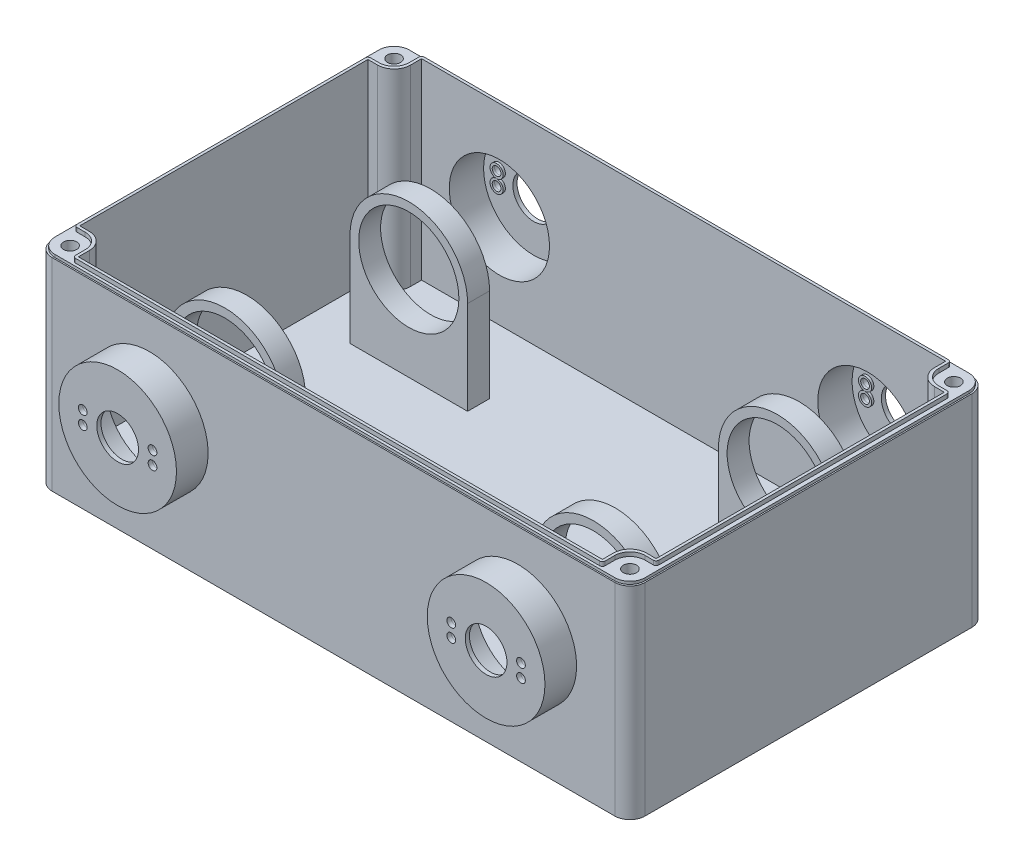
from build123d import *
from build123d.topology import SkipClean

# Parameters (mm, degrees)
SKETCH1_W              = 215.9
SKETCH1_H              = 130
BOSS_EXTRUDE1_DEPTH    = 73.7
SKETCH2_W              = 214.9
SKETCH2_H              = 129
BOSS_EXTRUDE2_DEPTH    = 1
FILLET1_R              = 5.5118
FILLET2_R              = 5.5118
M4_CLEARANCE_HOLE1_D   = 4.8
BOSS_EXTRUDE3_START    = 1.5
BOSS_EXTRUDE3_DEPTH    = 1.5
FILLET3_R              = 1
CUT_EXTRUDE2_DEPTH     = 69.85
SKETCH9_R              = 18.25
CUT_EXTRUDE3_DEPTH     = 186.363541453
BOSS_EXTRUDE5_START    = 10
SKETCH10_R             = 21.425
SKETCH10_R_2           = 18.25
BOSS_EXTRUDE5_DEPTH    = 10
BOSS_EXTRUDE6_START    = 1.525
SKETCH11_R             = 21.425
SKETCH11_R_2           = 7.59
BOSS_EXTRUDE6_DEPTH    = 1.525
SKETCH12_R             = 21.425
SKETCH12_R_2           = 18.25
BOSS_EXTRUDE7_DEPTH    = 10
SKETCH13_R             = 21.425
SKETCH13_R_2           = 7.59
BOSS_EXTRUDE8_DEPTH    = 1.525
BOSS_EXTRUDE9_START    = 25
SKETCH14_R             = 21.425
SKETCH14_R_2           = 18.25
BOSS_EXTRUDE9_DEPTH    = 8
BOSS_EXTRUDE9_2_DEPTH  = 8
BOSS_EXTRUDE11_DEPTH   = 8
BOSS_EXTRUDE12_START   = 25
SKETCH16_R             = 21.425
SKETCH16_R_2           = 18.25
BOSS_EXTRUDE12_DEPTH   = 8
BOSS_EXTRUDE12_2_DEPTH = 8
BOSS_EXTRUDE13_START   = -8
BOSS_EXTRUDE13_DEPTH   = 8
SKETCH18_R             = 1.5875
CUT_EXTRUDE4_DEPTH     = 203.197786833
SKETCH21_R             = 1.5875
BOSS_EXTRUDE14_DEPTH   = 0.825
BOSS_EXTRUDE14_2_DEPTH = 0.825
BOSS_EXTRUDE14_3_DEPTH = 0.825
BOSS_EXTRUDE14_4_DEPTH = 0.825
SKETCH22_R             = 1.5875
BOSS_EXTRUDE15_DEPTH   = 0.825
BOSS_EXTRUDE15_2_DEPTH = 0.825
BOSS_EXTRUDE15_3_DEPTH = 0.825
BOSS_EXTRUDE15_4_DEPTH = 0.825
SKETCH23_R             = 1.5875
BOSS_EXTRUDE16_DEPTH   = 0.825
BOSS_EXTRUDE16_2_DEPTH = 0.825
BOSS_EXTRUDE16_3_DEPTH = 0.825
BOSS_EXTRUDE16_4_DEPTH = 0.825
SKETCH24_R             = 1.5875
BOSS_EXTRUDE18_DEPTH   = 0.825
BOSS_EXTRUDE18_2_DEPTH = 0.825
BOSS_EXTRUDE18_3_DEPTH = 0.825
BOSS_EXTRUDE18_4_DEPTH = 0.825


with BuildPart() as part:
    # Sketch1 → Boss-Extrude1 (new body)
    with BuildSketch(Plane(origin=(0, 0, 0), x_dir=(1, 0, 0), z_dir=(0, 1, 0))):
        Rectangle(SKETCH1_W, SKETCH1_H)
    extrude(amount=BOSS_EXTRUDE1_DEPTH)

    # Sketch2 → Boss-Extrude2 (add)
    with BuildSketch(Plane(origin=(0, 73.7, 0), x_dir=(1, 0, 0), z_dir=(0, 1, 0))):
        Rectangle(SKETCH2_W, SKETCH2_H)
    extrude(amount=BOSS_EXTRUDE2_DEPTH)

    # Fillet1
    fillet1_edges = [part.edges().sort_by_distance(p)[0] for p in [
        (107.45, 74.2, -64.5),
        (107.45, 74.2, 64.5),
        (-107.45, 74.2, 64.5),
        (-107.45, 74.2, -64.5),
    ]]
    fillet(fillet1_edges, radius=FILLET1_R)

    # Fillet2
    fillet2_edges = [part.edges().sort_by_distance(p)[0] for p in [
        (-107.95, 36.85, 65),
        (107.95, 36.85, 65),
        (-107.95, 36.85, -65),
        (107.95, 36.85, -65),
    ]]
    fillet(fillet2_edges, radius=FILLET2_R)

    # M4 Clearance Hole1 (through all)
    with Locations(Plane(origin=(0, 74.7, 0), x_dir=(1, 0, 0), z_dir=(0, 1, 0))):
        with Locations((-101.9382, 58.9882), (-101.9382, -58.9882), (101.9382, -58.9882), (101.9382, 58.9882)):
            Hole(M4_CLEARANCE_HOLE1_D / 2)

    # Sketch7 → Boss-Extrude3 (add)
    with BuildSketch(Plane(origin=(0, 74.7, 0), x_dir=(1, 0, 0), z_dir=(0, 1, 0)).offset(BOSS_EXTRUDE3_START)):
        with BuildLine():
            Line((96.4264, 63.5), (-96.4264, 63.5))
            Line((-96.4264, 63.5), (-96.4264, 58.9882))
            ThreePointArc((-96.4264, 58.9882), (-98.040768843, 55.090768843), (-101.9382, 53.4764))
            Line((-101.9382, 53.4764), (-105.95, 53.4764))
            Line((-105.95, 53.4764), (-105.95, -53.4764))
            Line((-105.95, -53.4764), (-101.9382, -53.4764))
            ThreePointArc((-101.9382, -53.4764), (-98.040768843, -55.090768843), (-96.4264, -58.9882))
            Line((-96.4264, -58.9882), (-96.4264, -63.5))
            Line((-96.4264, -63.5), (96.4264, -63.5))
            Line((96.4264, -63.5), (96.4264, -58.9882))
            ThreePointArc((96.4264, -58.9882), (98.040768843, -55.090768843), (101.9382, -53.4764))
            Line((101.9382, -53.4764), (105.95, -53.4764))
            Line((105.95, -53.4764), (105.95, 53.4764))
            Line((105.95, 53.4764), (101.9382, 53.4764))
            ThreePointArc((101.9382, 53.4764), (98.040768843, 55.090768843), (96.4264, 58.9882))
            Line((96.4264, 58.9882), (96.4264, 63.5))
        make_face()
    extrude(amount=-BOSS_EXTRUDE3_DEPTH)

    # Fillet3
    fillet3_edges = [part.edges().sort_by_distance(p)[0] for p in [
        (96.4264, 75.45, 63.5),
        (105.95, 75.45, 53.4764),
        (105.95, 75.45, -53.4764),
        (96.4264, 75.45, -63.5),
        (-105.95, 75.45, -53.4764),
        (-96.4264, 75.45, -63.5),
        (-105.95, 75.45, 53.4764),
        (-96.4264, 75.45, 63.5),
    ]]
    fillet(fillet3_edges, radius=FILLET3_R)

    # Sketch8 → Cut-Extrude2 (cut)
    with BuildSketch(Plane(origin=(0, 76.2, 0), x_dir=(1, 0, 0), z_dir=(0, 1, 0))):
        with BuildLine():
            Line((95.4264, 62.5), (-95.4264, 62.5))
            Line((-95.4264, 62.5), (-95.4264, 58.4764))
            ThreePointArc((-95.4264, 58.4764), (-97.183759313, 54.233759313), (-101.4264, 52.4764))
            Line((-101.4264, 52.4764), (-104.95, 52.4764))
            Line((-104.95, 52.4764), (-104.95, -52.4764))
            Line((-104.95, -52.4764), (-101.4264, -52.4764))
            ThreePointArc((-101.4264, -52.4764), (-97.183759313, -54.233759313), (-95.4264, -58.4764))
            Line((-95.4264, -58.4764), (-95.4264, -62.5))
            Line((-95.4264, -62.5), (95.4264, -62.5))
            Line((95.4264, -62.5), (95.4264, -58.4764))
            ThreePointArc((95.4264, -58.4764), (97.183759313, -54.233759313), (101.4264, -52.4764))
            Line((101.4264, -52.4764), (104.95, -52.4764))
            Line((104.95, -52.4764), (104.95, 52.4764))
            Line((104.95, 52.4764), (101.4264, 52.4764))
            ThreePointArc((101.4264, 52.4764), (97.183759313, 54.233759313), (95.4264, 58.4764))
            Line((95.4264, 58.4764), (95.4264, 62.5))
        make_face()
    extrude(amount=-CUT_EXTRUDE2_DEPTH, mode=Mode.SUBTRACT)

    # Sketch9 → Cut-Extrude3 (cut, through all)
    with BuildSketch(Plane.XY.offset(65)):
        with Locations((-67.0941, 40.35)):
            Circle(SKETCH9_R)
        with Locations((67.0941, 40.35)):
            Circle(SKETCH9_R)
    extrude(amount=-CUT_EXTRUDE3_DEPTH, mode=Mode.SUBTRACT)

    # Sketch10 → Boss-Extrude5 (add)
    # profile 1 of 2: a face of its own
    with BuildSketch(Plane.XY.offset(65).offset(BOSS_EXTRUDE5_START)):
        with Locations((-67.0941, 40.35)):
            Circle(SKETCH10_R)
        with Locations((-67.0941, 40.35)):
            Circle(SKETCH10_R_2, mode=Mode.SUBTRACT)
    # profile 2 of 2: a face of its own
    with BuildSketch(Plane.XY.offset(65).offset(BOSS_EXTRUDE5_START)):
        with Locations((67.0941, 40.35)):
            Circle(SKETCH10_R)
        with Locations((67.0941, 40.35)):
            Circle(SKETCH10_R_2, mode=Mode.SUBTRACT)
    extrude(amount=-BOSS_EXTRUDE5_DEPTH)

    # Sketch11 → Boss-Extrude6 (add)
    # profile 1 of 2: a face of its own
    with BuildSketch(Plane.XY.offset(75).offset(BOSS_EXTRUDE6_START)):
        with Locations((-67.0941, 40.35)):
            Circle(SKETCH11_R)
        with Locations((-67.0941, 40.35)):
            Circle(SKETCH11_R_2, mode=Mode.SUBTRACT)
    # profile 2 of 2: a face of its own
    with BuildSketch(Plane.XY.offset(75).offset(BOSS_EXTRUDE6_START)):
        with Locations((67.0941, 40.35)):
            Circle(SKETCH11_R)
        with Locations((67.0941, 40.35)):
            Circle(SKETCH11_R_2, mode=Mode.SUBTRACT)
    extrude(amount=-BOSS_EXTRUDE6_DEPTH)

    # Sketch12 → Boss-Extrude7 (add)
    # profile 1 of 2: a face of its own
    with SkipClean():  # the faces are left unmerged after this step: merging them gives an invalid solid
        with BuildSketch(Plane(origin=(0, 0, -65), x_dir=(-1, 0, 0), z_dir=(0, 0, -1))):
            with Locations((-67.0941, 40.35)):
                Circle(SKETCH12_R)
            with Locations((-67.0941, 40.35)):
                Circle(SKETCH12_R_2, mode=Mode.SUBTRACT)
        # profile 2 of 2: a face of its own
        with BuildSketch(Plane(origin=(0, 0, -65), x_dir=(-1, 0, 0), z_dir=(0, 0, -1))):
            with Locations((67.0941, 40.35)):
                Circle(SKETCH12_R)
            with Locations((67.0941, 40.35)):
                Circle(SKETCH12_R_2, mode=Mode.SUBTRACT)
        extrude(amount=BOSS_EXTRUDE7_DEPTH)

    # Sketch13 → Boss-Extrude8 (add)
    # profile 1 of 2: a face of its own
    with SkipClean():  # the faces are left unmerged after this step: merging them gives an invalid solid
        with BuildSketch(Plane(origin=(0, 0, -75), x_dir=(-1, 0, 0), z_dir=(0, 0, -1))):
            with Locations((-67.0941, 40.35)):
                Circle(SKETCH13_R)
            with Locations((-67.0941, 40.35)):
                Circle(SKETCH13_R_2, mode=Mode.SUBTRACT)
        # profile 2 of 2: a face of its own
        with BuildSketch(Plane(origin=(0, 0, -75), x_dir=(-1, 0, 0), z_dir=(0, 0, -1))):
            with Locations((67.0941, 40.35)):
                Circle(SKETCH13_R)
            with Locations((67.0941, 40.35)):
                Circle(SKETCH13_R_2, mode=Mode.SUBTRACT)
        extrude(amount=BOSS_EXTRUDE8_DEPTH)



with BuildPart() as body_2:
    # Sketch14 → Boss-Extrude9 (new body)
    with BuildSketch(Plane.XY.offset(-62.5).offset(BOSS_EXTRUDE9_START)):
        with Locations((-67.0941, 40.35)):
            Circle(SKETCH14_R)
        with Locations((-67.0941, 40.35)):
            Circle(SKETCH14_R_2, mode=Mode.SUBTRACT)
    extrude(amount=BOSS_EXTRUDE9_DEPTH)


with BuildPart() as body_3:
    # Sketch14 → Boss-Extrude9 2 (new body)
    with BuildSketch(Plane.XY.offset(-62.5).offset(BOSS_EXTRUDE9_START)):
        with Locations((67.0941, 40.35)):
            Circle(SKETCH14_R)
        with Locations((67.0941, 40.35)):
            Circle(SKETCH14_R_2, mode=Mode.SUBTRACT)
    extrude(amount=BOSS_EXTRUDE9_2_DEPTH)


with BuildPart() as part_1:
    with SkipClean():  # the faces are left unmerged after this step: merging them gives an invalid solid
        add(part.part)

        add(body_2.part)  # Boss-Extrude11 merges body 2

        add(body_3.part)  # Boss-Extrude11 merges body 3
        # Sketch15 → Boss-Extrude11 (add)
        with BuildSketch(Plane.XY.offset(-29.5)):
            with BuildLine():
                ThreePointArc((-45.6691, 40.35), (-67.0941, 18.925), (-88.5191, 40.35))
                Line((-88.5191, 40.35), (-88.5191, 6.35))
                Line((-88.5191, 6.35), (-45.6691, 6.35))
                Line((-45.6691, 6.35), (-45.6691, 40.35))
            make_face()
            with BuildLine():
                ThreePointArc((88.5191, 40.35), (67.0941, 18.925), (45.6691, 40.35))
                Line((45.6691, 40.35), (45.6691, 6.35))
                Line((45.6691, 6.35), (88.5191, 6.35))
                Line((88.5191, 6.35), (88.5191, 40.35))
            make_face()
        extrude(amount=-BOSS_EXTRUDE11_DEPTH)



with BuildPart() as body_2_2:
    # Sketch16 → Boss-Extrude12 (new body)
    with BuildSketch(Plane(origin=(0, 0, 62.5), x_dir=(-1, 0, 0), z_dir=(0, 0, -1)).offset(BOSS_EXTRUDE12_START)):
        with Locations((-67.0941, 40.35)):
            Circle(SKETCH16_R)
        with Locations((-67.0941, 40.35)):
            Circle(SKETCH16_R_2, mode=Mode.SUBTRACT)
    extrude(amount=BOSS_EXTRUDE12_DEPTH)


with BuildPart() as body_3_2:
    # Sketch16 → Boss-Extrude12 2 (new body)
    with BuildSketch(Plane(origin=(0, 0, 62.5), x_dir=(-1, 0, 0), z_dir=(0, 0, -1)).offset(BOSS_EXTRUDE12_START)):
        with Locations((67.0941, 40.35)):
            Circle(SKETCH16_R)
        with Locations((67.0941, 40.35)):
            Circle(SKETCH16_R_2, mode=Mode.SUBTRACT)
    extrude(amount=BOSS_EXTRUDE12_2_DEPTH)


with BuildPart() as part_2:
    with SkipClean():  # the faces are left unmerged after this step: merging them gives an invalid solid
        add(part_1.part)

        add(body_2_2.part)  # Boss-Extrude13 merges body 2 2

        add(body_3_2.part)  # Boss-Extrude13 merges body 3 2
        # Sketch17 → Boss-Extrude13 (add)
        with BuildSketch(Plane(origin=(0, 0, 29.5), x_dir=(-1, 0, 0), z_dir=(0, 0, -1)).offset(BOSS_EXTRUDE13_START)):
            with BuildLine():
                ThreePointArc((-45.6691, 40.35), (-67.0941, 18.925), (-88.5191, 40.35))
                Line((-88.5191, 40.35), (-88.5191, 6.35))
                Line((-88.5191, 6.35), (-45.6691, 6.35))
                Line((-45.6691, 6.35), (-45.6691, 40.35))
            make_face()
            with BuildLine():
                Line((88.5191, 6.35), (88.5191, 40.35))
                ThreePointArc((88.5191, 40.35), (67.0941, 18.925), (45.6691, 40.35))
                Line((45.6691, 40.35), (45.6691, 6.35))
                Line((45.6691, 6.35), (88.5191, 6.35))
            make_face()
        extrude(amount=BOSS_EXTRUDE13_DEPTH)

    # Sketch18 → Cut-Extrude4 (cut, through all)
    with SkipClean():  # the faces are left unmerged after this step: merging them gives an invalid solid
        with BuildSketch(Plane(origin=(0, 0, -76.525), x_dir=(-1, 0, 0), z_dir=(0, 0, -1))):
            with Locations((-79.7941, 42.73125)):
                Circle(SKETCH18_R)
            with Locations((-79.7941, 37.96875)):
                Circle(SKETCH18_R)
            with Locations((-54.3941, 42.73125)):
                Circle(SKETCH18_R)
            with Locations((-54.3941, 37.96875)):
                Circle(SKETCH18_R)
        cut_extrude4 = extrude(amount=-CUT_EXTRUDE4_DEPTH, mode=Mode.SUBTRACT)

    # Mirror1: Cut-Extrude4 across plane
    with SkipClean():  # the faces are left unmerged after this step: merging them gives an invalid solid
        add(cut_extrude4.mirror(Plane(origin=(0, 0, 0), x_dir=(0, 0, 1), z_dir=(1, 0, 0))), mode=Mode.SUBTRACT)


with BuildPart() as body_2_3:
    # Sketch21 → Boss-Extrude14 (new body)
    with BuildSketch(Plane.XY.offset(-75)):
        with BuildLine():
            ThreePointArc((54.566740341, 40.35), (54.3941, 45.11875), (54.221459659, 40.35))
            ThreePointArc((54.221459659, 40.35), (54.3941, 40.35625), (54.566740341, 40.35))
        make_face()
        with Locations((54.3941, 42.73125)):
            Circle(SKETCH21_R, mode=Mode.SUBTRACT)
    extrude(amount=BOSS_EXTRUDE14_DEPTH)


with BuildPart() as body_3_3:
    # Sketch21 → Boss-Extrude14 2 (new body)
    with BuildSketch(Plane.XY.offset(-75)):
        with BuildLine():
            ThreePointArc((54.566740341, 40.35), (54.3941, 40.34375), (54.221459659, 40.35))
            ThreePointArc((54.221459659, 40.35), (54.3941, 35.58125), (54.566740341, 40.35))
        make_face()
        with Locations((54.3941, 37.96875)):
            Circle(SKETCH21_R, mode=Mode.SUBTRACT)
    extrude(amount=BOSS_EXTRUDE14_2_DEPTH)


with BuildPart() as body_4:
    # Sketch21 → Boss-Extrude14 3 (new body)
    with BuildSketch(Plane.XY.offset(-75)):
        with BuildLine():
            ThreePointArc((79.966740341, 40.35), (79.7941, 45.11875), (79.621459659, 40.35))
            ThreePointArc((79.621459659, 40.35), (79.7941, 40.35625), (79.966740341, 40.35))
        make_face()
        with Locations((79.7941, 42.73125)):
            Circle(SKETCH21_R, mode=Mode.SUBTRACT)
    extrude(amount=BOSS_EXTRUDE14_3_DEPTH)


with BuildPart() as body_5:
    # Sketch21 → Boss-Extrude14 4 (new body)
    with BuildSketch(Plane.XY.offset(-75)):
        with BuildLine():
            ThreePointArc((79.966740341, 40.35), (79.7941, 40.34375), (79.621459659, 40.35))
            ThreePointArc((79.621459659, 40.35), (79.7941, 35.58125), (79.966740341, 40.35))
        make_face()
        with Locations((79.7941, 37.96875)):
            Circle(SKETCH21_R, mode=Mode.SUBTRACT)
    extrude(amount=BOSS_EXTRUDE14_4_DEPTH)


with BuildPart() as body_6:
    # Sketch22 → Boss-Extrude15 (new body)
    with BuildSketch(Plane.XY.offset(-75)):
        with BuildLine():
            ThreePointArc((-79.621459659, 40.35), (-79.7941, 45.11875), (-79.966740341, 40.35))
            ThreePointArc((-79.966740341, 40.35), (-79.7941, 40.35625), (-79.621459659, 40.35))
        make_face()
        with Locations((-79.7941, 42.73125)):
            Circle(SKETCH22_R, mode=Mode.SUBTRACT)
    extrude(amount=BOSS_EXTRUDE15_DEPTH)


with BuildPart() as body_7:
    # Sketch22 → Boss-Extrude15 2 (new body)
    with BuildSketch(Plane.XY.offset(-75)):
        with BuildLine():
            ThreePointArc((-79.621459659, 40.35), (-79.7941, 40.34375), (-79.966740341, 40.35))
            ThreePointArc((-79.966740341, 40.35), (-79.7941, 35.58125), (-79.621459659, 40.35))
        make_face()
        with Locations((-79.7941, 37.96875)):
            Circle(SKETCH22_R, mode=Mode.SUBTRACT)
    extrude(amount=BOSS_EXTRUDE15_2_DEPTH)


with BuildPart() as body_8:
    # Sketch22 → Boss-Extrude15 3 (new body)
    with BuildSketch(Plane.XY.offset(-75)):
        with BuildLine():
            ThreePointArc((-54.221459659, 40.35), (-54.3941, 45.11875), (-54.566740341, 40.35))
            ThreePointArc((-54.566740341, 40.35), (-54.3941, 40.35625), (-54.221459659, 40.35))
        make_face()
        with Locations((-54.3941, 42.73125)):
            Circle(SKETCH22_R, mode=Mode.SUBTRACT)
    extrude(amount=BOSS_EXTRUDE15_3_DEPTH)


with BuildPart() as body_9:
    # Sketch22 → Boss-Extrude15 4 (new body)
    with BuildSketch(Plane.XY.offset(-75)):
        with BuildLine():
            ThreePointArc((-54.221459659, 40.35), (-54.3941, 40.34375), (-54.566740341, 40.35))
            ThreePointArc((-54.566740341, 40.35), (-54.3941, 35.58125), (-54.221459659, 40.35))
        make_face()
        with Locations((-54.3941, 37.96875)):
            Circle(SKETCH22_R, mode=Mode.SUBTRACT)
    extrude(amount=BOSS_EXTRUDE15_4_DEPTH)


with BuildPart() as body_10:
    # Sketch23 → Boss-Extrude16 (new body)
    with BuildSketch(Plane(origin=(0, 0, 75), x_dir=(-1, 0, 0), z_dir=(0, 0, -1))):
        with BuildLine():
            ThreePointArc((-79.621459659, 40.35), (-79.7941, 45.11875), (-79.966740341, 40.35))
            ThreePointArc((-79.966740341, 40.35), (-79.7941, 40.35625), (-79.621459659, 40.35))
        make_face()
        with Locations((-79.7941, 42.73125)):
            Circle(SKETCH23_R, mode=Mode.SUBTRACT)
    extrude(amount=BOSS_EXTRUDE16_DEPTH)


with BuildPart() as body_11:
    # Sketch23 → Boss-Extrude16 2 (new body)
    with BuildSketch(Plane(origin=(0, 0, 75), x_dir=(-1, 0, 0), z_dir=(0, 0, -1))):
        with BuildLine():
            ThreePointArc((-79.621459659, 40.35), (-79.7941, 40.34375), (-79.966740341, 40.35))
            ThreePointArc((-79.966740341, 40.35), (-79.7941, 35.58125), (-79.621459659, 40.35))
        make_face()
        with Locations((-79.7941, 37.96875)):
            Circle(SKETCH23_R, mode=Mode.SUBTRACT)
    extrude(amount=BOSS_EXTRUDE16_2_DEPTH)


with BuildPart() as body_12:
    # Sketch23 → Boss-Extrude16 3 (new body)
    with BuildSketch(Plane(origin=(0, 0, 75), x_dir=(-1, 0, 0), z_dir=(0, 0, -1))):
        with BuildLine():
            ThreePointArc((-54.221459659, 40.35), (-54.3941, 45.11875), (-54.566740341, 40.35))
            ThreePointArc((-54.566740341, 40.35), (-54.3941, 40.35625), (-54.221459659, 40.35))
        make_face()
        with Locations((-54.3941, 42.73125)):
            Circle(SKETCH23_R, mode=Mode.SUBTRACT)
    extrude(amount=BOSS_EXTRUDE16_3_DEPTH)


with BuildPart() as body_13:
    # Sketch23 → Boss-Extrude16 4 (new body)
    with BuildSketch(Plane(origin=(0, 0, 75), x_dir=(-1, 0, 0), z_dir=(0, 0, -1))):
        with BuildLine():
            ThreePointArc((-54.221459659, 40.35), (-54.3941, 40.34375), (-54.566740341, 40.35))
            ThreePointArc((-54.566740341, 40.35), (-54.3941, 35.58125), (-54.221459659, 40.35))
        make_face()
        with Locations((-54.3941, 37.96875)):
            Circle(SKETCH23_R, mode=Mode.SUBTRACT)
    extrude(amount=BOSS_EXTRUDE16_4_DEPTH)


with BuildPart() as body_14:
    # Sketch24 → Boss-Extrude18 (new body)
    with BuildSketch(Plane(origin=(0, 0, 75), x_dir=(-1, 0, 0), z_dir=(0, 0, -1))):
        with BuildLine():
            ThreePointArc((54.566740341, 40.35), (54.3941, 45.11875), (54.221459659, 40.35))
            ThreePointArc((54.221459659, 40.35), (54.3941, 40.35625), (54.566740341, 40.35))
        make_face()
        with Locations((54.3941, 42.73125)):
            Circle(SKETCH24_R, mode=Mode.SUBTRACT)
    extrude(amount=BOSS_EXTRUDE18_DEPTH)


with BuildPart() as body_15:
    # Sketch24 → Boss-Extrude18 2 (new body)
    with BuildSketch(Plane(origin=(0, 0, 75), x_dir=(-1, 0, 0), z_dir=(0, 0, -1))):
        with BuildLine():
            ThreePointArc((54.566740341, 40.35), (54.3941, 40.34375), (54.221459659, 40.35))
            ThreePointArc((54.221459659, 40.35), (54.3941, 35.58125), (54.566740341, 40.35))
        make_face()
        with Locations((54.3941, 37.96875)):
            Circle(SKETCH24_R, mode=Mode.SUBTRACT)
    extrude(amount=BOSS_EXTRUDE18_2_DEPTH)


with BuildPart() as body_16:
    # Sketch24 → Boss-Extrude18 3 (new body)
    with BuildSketch(Plane(origin=(0, 0, 75), x_dir=(-1, 0, 0), z_dir=(0, 0, -1))):
        with BuildLine():
            ThreePointArc((79.966740341, 40.35), (79.7941, 45.11875), (79.621459659, 40.35))
            ThreePointArc((79.621459659, 40.35), (79.7941, 40.35625), (79.966740341, 40.35))
        make_face()
        with Locations((79.7941, 42.73125)):
            Circle(SKETCH24_R, mode=Mode.SUBTRACT)
    extrude(amount=BOSS_EXTRUDE18_3_DEPTH)


with BuildPart() as body_17:
    # Sketch24 → Boss-Extrude18 4 (new body)
    with BuildSketch(Plane(origin=(0, 0, 75), x_dir=(-1, 0, 0), z_dir=(0, 0, -1))):
        with BuildLine():
            ThreePointArc((79.966740341, 40.35), (79.7941, 40.34375), (79.621459659, 40.35))
            ThreePointArc((79.621459659, 40.35), (79.7941, 35.58125), (79.966740341, 40.35))
        make_face()
        with Locations((79.7941, 37.96875)):
            Circle(SKETCH24_R, mode=Mode.SUBTRACT)
    extrude(amount=BOSS_EXTRUDE18_4_DEPTH)


solid = Compound([part_2.part, body_2_3.part, body_3_3.part, body_4.part, body_5.part, body_6.part, body_7.part, body_8.part, body_9.part, body_10.part, body_11.part, body_12.part, body_13.part, body_14.part, body_15.part, body_16.part, body_17.part])
